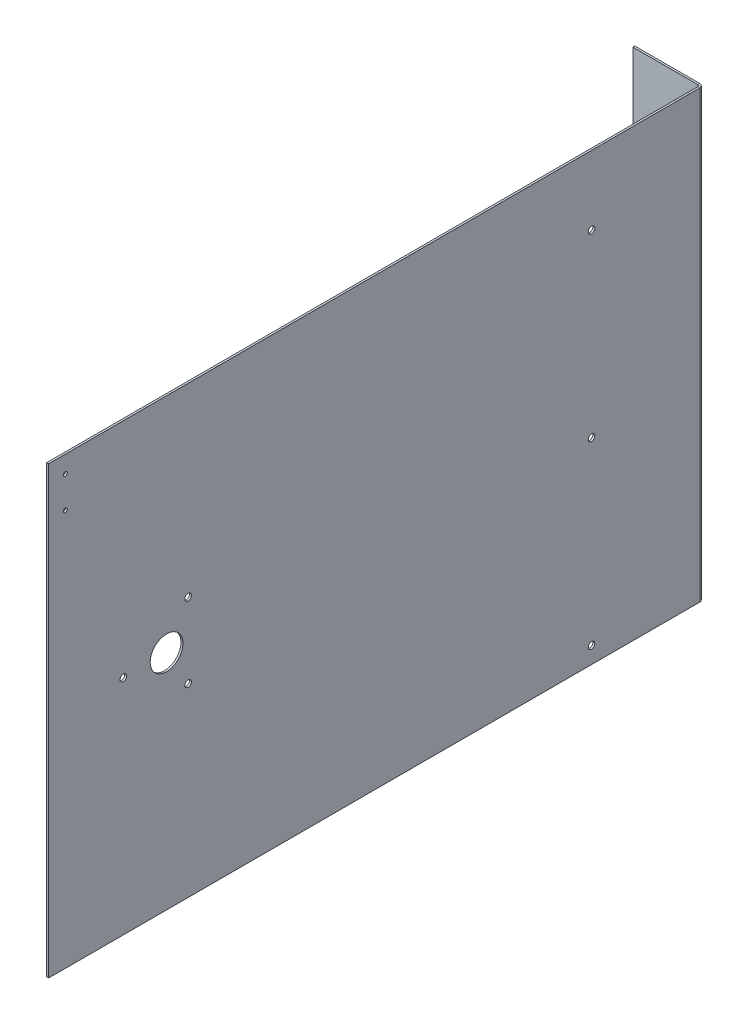
from build123d import *

# Parameters (mm, degrees)
SKETCH1_W                  = 340
SKETCH1_H                  = 550
BOSS_EXTRUDE1_DEPTH        = 1.3
F_5_0_5_DIAMETER_HOLE1_D   = 5
CONVERT_SOLID1_START       = -0.2
CONVERT_SOLID1_OUTLINE_W   = 340
CONVERT_SOLID1_OUTLINE_H   = 550
CONVERT_SOLID1_OUTLINE_R   = 2.5
CONVERT_SOLID1_DEPTH       = 0.2
SKETCHED_START             = -275
SKETCHED_BEND1_OUTLINE_W   = 1.5
SKETCHED_BEND1_OUTLINE_H   = 340
SKETCHED_BEND1_DEPTH       = 50.30822
SKETCHED_START_2           = -225
SKETCHED_BEND1_2_OUTLINE_W = 50.965708265
SKETCHED_BEND1_2_OUTLINE_H = 340
SKETCHED_BEND1_2_OUTLINE_R = 2.5
SKETCHED_BEND1_2_DEPTH     = 3
SKETCHED_START_3           = -171
SKETCHED_BEND1_3_DEPTH     = 342
F_5_0_5_DIAMETER_HOLE2_D   = 5
SKETCH10_2_R               = 12.5
CUT_EXTRUDE1_DEPTH         = 328.532670956
CUT_EXTRUDE3_DEPTH         = 328.32694619
CUT_EXTRUDE3_DEPTH_BACK    = 328.32694619
SKETCH1_4_R                = 1.5


with BuildPart() as part:
    # Sketch1 → Boss-Extrude1 (new body)
    with BuildSketch(Plane.YZ):
        Rectangle(SKETCH1_W, SKETCH1_H)
    extrude(amount=BOSS_EXTRUDE1_DEPTH)

    # Ø5.0 (5) Diameter Hole1 (through all)
    with Locations(Plane.YZ.offset(1.3)):
        with Locations((-157.3, -139.45), (-20, -139.45), (117.3, -139.45), (140, -250), (0, -250), (-140, -250)):
            Hole(F_5_0_5_DIAMETER_HOLE1_D / 2)

    # Convert-Solid1: read off the stored shape, not the designer's step
    # Convert-Solid1 outline → Convert-Solid1 (add)
    with BuildSketch(Plane.YZ.offset(CONVERT_SOLID1_START)):
        Rectangle(CONVERT_SOLID1_OUTLINE_W, CONVERT_SOLID1_OUTLINE_H)
        with Locations((-140, -250)):
            Circle(CONVERT_SOLID1_OUTLINE_R, mode=Mode.SUBTRACT)
        with Locations((-157.3, -139.45)):
            Circle(CONVERT_SOLID1_OUTLINE_R, mode=Mode.SUBTRACT)
        with Locations((-20, -139.45)):
            Circle(CONVERT_SOLID1_OUTLINE_R, mode=Mode.SUBTRACT)
        with Locations((0, -250)):
            Circle(CONVERT_SOLID1_OUTLINE_R, mode=Mode.SUBTRACT)
        with Locations((140, -250)):
            Circle(CONVERT_SOLID1_OUTLINE_R, mode=Mode.SUBTRACT)
        with Locations((117.3, -139.45)):
            Circle(CONVERT_SOLID1_OUTLINE_R, mode=Mode.SUBTRACT)
    extrude(amount=CONVERT_SOLID1_DEPTH)

    # Sketched Bend1: read off the stored shape, not the designer's step
    # Sketched Bend1 outline → Sketched Bend1 (cut)
    with BuildSketch(Plane.XY.offset(SKETCHED_START)):
        with Locations((0.55, 0)):
            Rectangle(SKETCHED_BEND1_OUTLINE_W, SKETCHED_BEND1_OUTLINE_H)
    extrude(amount=SKETCHED_BEND1_DEPTH, mode=Mode.SUBTRACT)

    # Sketched Bend1 2 outline → Sketched Bend1 2 (add)
    with BuildSketch(Plane.XY.offset(SKETCHED_START_2)):
        with Locations((-25.682854133, 0)):
            Rectangle(SKETCHED_BEND1_2_OUTLINE_W, SKETCHED_BEND1_2_OUTLINE_H)
        with Locations((-26.165708265, -140)):
            Circle(SKETCHED_BEND1_2_OUTLINE_R, mode=Mode.SUBTRACT)
        with Locations((-26.165708265, 0)):
            Circle(SKETCHED_BEND1_2_OUTLINE_R, mode=Mode.SUBTRACT)
        with Locations((-26.165708265, 140)):
            Circle(SKETCHED_BEND1_2_OUTLINE_R, mode=Mode.SUBTRACT)
    extrude(amount=SKETCHED_BEND1_2_DEPTH)

    # Sketched Bend1 3 outline → Sketched Bend1 3 (cut)
    with BuildSketch(Plane(origin=(0, 0, 0), x_dir=(1, 0, 0), z_dir=(0, 1, 0)).offset(SKETCHED_START_3)):
        with BuildLine():
            ThreePointArc((-0.2, 222), (-0.639339828, 223.060660172), (-1.7, 223.5))
            Line((-1.7, 223.5), (-51.165708265, 223.5))
            Line((-51.165708265, 223.5), (-51.165708265, 222))
            Line((-51.165708265, 222), (-0.2, 222))
        make_face()
        with BuildLine():
            Line((-0.2, 225), (-1.7, 225))
            ThreePointArc((-1.7, 225), (0.421320344, 224.121320344), (1.3, 222))
            Line((1.3, 222), (1.3, 224.69178))
            Line((1.3, 224.69178), (-0.2, 224.69178))
            Line((-0.2, 224.69178), (-0.2, 225))
        make_face()
    extrude(amount=SKETCHED_BEND1_3_DEPTH, mode=Mode.SUBTRACT)

    # Ø5.0 (5) Diameter Hole2 (through all)
    with Locations(Plane.YZ.offset(1.3)):
        with Locations((-28.578838325, 168.5), (0, 218), (28.578838325, 168.5)):
            Hole(F_5_0_5_DIAMETER_HOLE2_D / 2)

    # Sketch10<2> → Cut-Extrude1 (cut, through all)
    with BuildSketch(Plane.YZ.offset(1.3)):
        with Locations(Location((0, 185, 0), (0, 0, 270))):
            Circle(SKETCH10_2_R)
    extrude(amount=-CUT_EXTRUDE1_DEPTH, mode=Mode.SUBTRACT)

    # Sketch1<4> → Cut-Extrude3 (cut, two sides: drawn at the far end of the back side and taken through both)
    with BuildSketch(Plane.YZ.offset(-CUT_EXTRUDE3_DEPTH_BACK)):
        with Locations(Location((156.891480577, 262.3, 0), (0, 0, 270))):
            Circle(SKETCH1_4_R)
        with Locations(Location((132.789034574, 262.3, 0), (0, 0, 270))):
            Circle(SKETCH1_4_R)
    extrude(amount=CUT_EXTRUDE3_DEPTH + CUT_EXTRUDE3_DEPTH_BACK, mode=Mode.SUBTRACT)


solid = part.part
